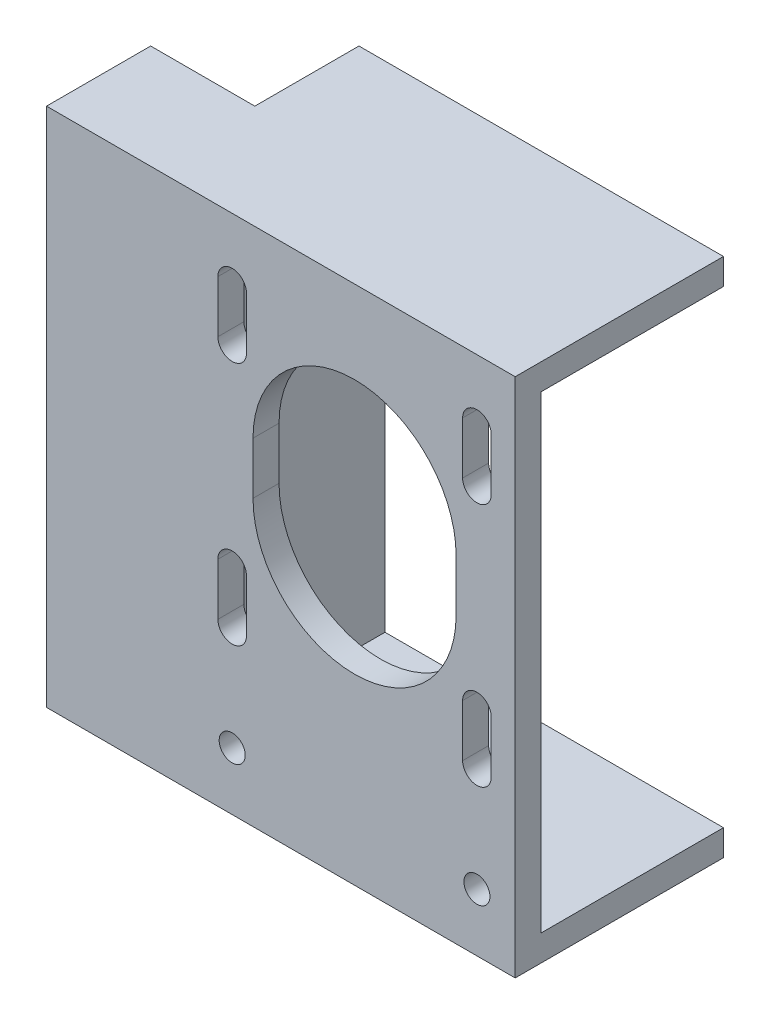
from build123d import *

# Parameters (mm, degrees)
SKETCH1_W           = 90
SKETCH1_H           = 100
BOSS_EXTRUDE1_DEPTH = 20
SKETCH2_W           = 5
SKETCH2_H           = 100
BOSS_EXTRUDE2_DEPTH = 20
SKETCH3_W           = 65
SKETCH3_H           = 5
BOSS_EXTRUDE3_DEPTH = 20
SKETCH5_R           = 2.5
CUT_EXTRUDE1_DEPTH  = 20
SKETCH6_W           = 65
SKETCH6_H           = 90
CUT_EXTRUDE2_DEPTH  = 15


with BuildPart() as part:
    # Sketch1 → Boss-Extrude1 (new body)
    with BuildSketch(Plane.XY):
        with Locations((-2.788018433, -1.33640553)):
            Rectangle(SKETCH1_W, SKETCH1_H)
    extrude(amount=BOSS_EXTRUDE1_DEPTH)

    # Sketch2 → Boss-Extrude2 (add)
    with BuildSketch(Plane(origin=(0, 0, 0), x_dir=(-1, 0, 0), z_dir=(0, 0, -1))):
        with Locations((25.288018433, -1.33640553)):
            Rectangle(SKETCH2_W, SKETCH2_H)
    extrude(amount=BOSS_EXTRUDE2_DEPTH)

    # Sketch3 → Boss-Extrude3 (add)
    with BuildSketch(Plane(origin=(0, 0, 0), x_dir=(-1, 0, 0), z_dir=(0, 0, -1))):
        with Locations((-9.711981567, 46.16359447)):
            Rectangle(SKETCH3_W, SKETCH3_H)
        with Locations((-9.711981567, -48.83640553)):
            Rectangle(SKETCH3_W, SKETCH3_H)
    extrude(amount=BOSS_EXTRUDE3_DEPTH)

    # Sketch5 → Cut-Extrude1 (cut)
    with BuildSketch(Plane.XY.offset(20)):
        with Locations((-12.134898038, -40.23392614)):
            Circle(SKETCH5_R)
        with Locations((34.865101962, -40.23392614)):
            Circle(SKETCH5_R)
        with BuildLine():
            Line((-14.882000862, -20.23392614), (-14.882000862, -10.23392614))
            ThreePointArc((-14.882000862, -10.23392614), (-12.134898038, -7.486823316), (-9.387795214, -10.23392614))
            Line((-9.387795214, -10.23392614), (-9.387795214, -20.23392614))
            ThreePointArc((-9.387795214, -20.23392614), (-12.134898038, -22.981028964), (-14.882000862, -20.23392614))
        make_face()
        with BuildLine():
            Line((-8.134898038, 3.26607386), (-8.134898038, 13.26607386))
            ThreePointArc((-8.134898038, 13.26607386), (11.365101962, 32.76607386), (30.865101962, 13.26607386))
            Line((30.865101962, 13.26607386), (30.865101962, 3.26607386))
            ThreePointArc((30.865101962, 3.26607386), (11.365101962, -16.23392614), (-8.134898038, 3.26607386))
        make_face()
        with BuildLine():
            Line((32.117999138, -20.23392614), (32.117999138, -10.23392614))
            ThreePointArc((32.117999138, -10.23392614), (34.865101962, -7.486823316), (37.612204786, -10.23392614))
            Line((37.612204786, -10.23392614), (37.612204786, -20.23392614))
            ThreePointArc((37.612204786, -20.23392614), (34.865101962, -22.981028964), (32.117999138, -20.23392614))
        make_face()
        with BuildLine():
            Line((32.117999138, 26.76607386), (32.117999138, 36.76607386))
            ThreePointArc((32.117999138, 36.76607386), (34.865101962, 39.513176684), (37.612204786, 36.76607386))
            Line((37.612204786, 36.76607386), (37.612204786, 26.76607386))
            ThreePointArc((37.612204786, 26.76607386), (34.865101962, 24.018971036), (32.117999138, 26.76607386))
        make_face()
        with BuildLine():
            Line((-14.882000862, 26.76607386), (-14.882000862, 36.76607386))
            ThreePointArc((-14.882000862, 36.76607386), (-12.134898038, 39.513176684), (-9.387795214, 36.76607386))
            Line((-9.387795214, 36.76607386), (-9.387795214, 26.76607386))
            ThreePointArc((-9.387795214, 26.76607386), (-12.134898038, 24.018971036), (-14.882000862, 26.76607386))
        make_face()
    extrude(amount=-CUT_EXTRUDE1_DEPTH, mode=Mode.SUBTRACT)

    # Sketch6 → Cut-Extrude2 (cut)
    with BuildSketch(Plane(origin=(0, 0, 0), x_dir=(-1, 0, 0), z_dir=(0, 0, -1))):
        with Locations((-9.711981567, -1.33640553)):
            Rectangle(SKETCH6_W, SKETCH6_H)
    extrude(amount=-CUT_EXTRUDE2_DEPTH, mode=Mode.SUBTRACT)


solid = part.part
